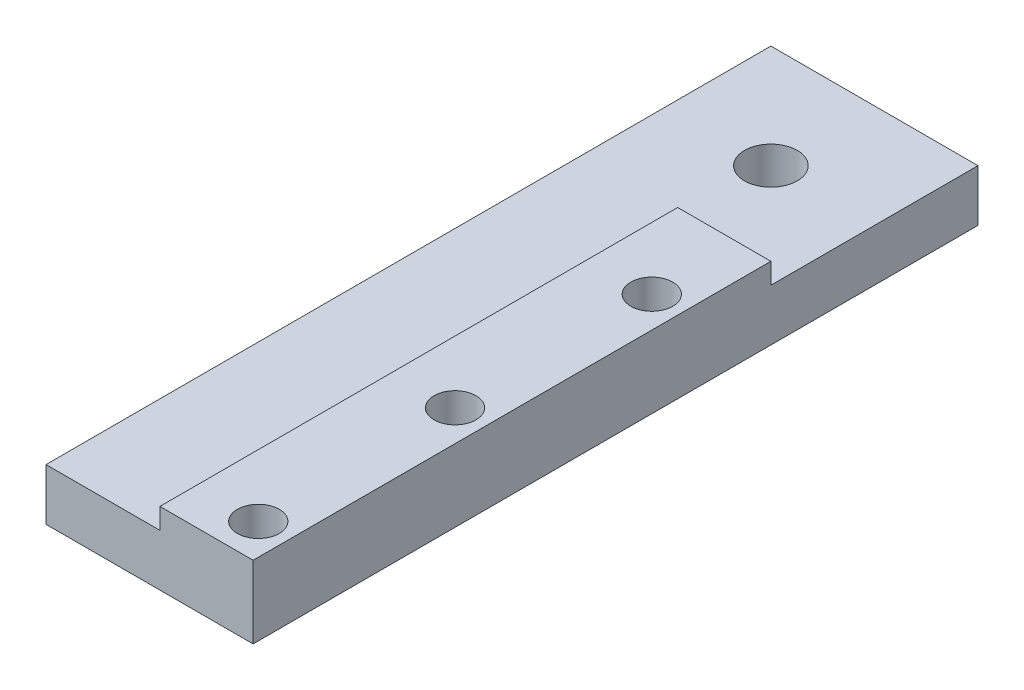
from build123d import *

# Parameters (mm, degrees)
SKETCH1_W           = 20
SKETCH1_H           = 70
SKETCH1_R           = 2.025
SKETCH1_R_2         = 2.55
BOSS_EXTRUDE1_DEPTH = 5
BOSS_EXTRUDE2_START = 2
SKETCH1_3_W         = 9
SKETCH1_3_H         = 50
SKETCH1_3_R         = 2.025
BOSS_EXTRUDE2_DEPTH = 2


with BuildPart() as part:
    # Sketch1 → Boss-Extrude1 (new body)
    with BuildSketch(Plane(origin=(0, 0, 0), x_dir=(1, 0, 0), z_dir=(0, 1, 0))):
        with Locations((-1, 35)):
            Rectangle(SKETCH1_W, SKETCH1_H)
        with Locations((6, 3.499356869)):
            Circle(SKETCH1_R, mode=Mode.SUBTRACT)
        with Locations((6, 22.499356869)):
            Circle(SKETCH1_R, mode=Mode.SUBTRACT)
        with Locations((6, 41.499356869)):
            Circle(SKETCH1_R, mode=Mode.SUBTRACT)
        with Locations((-1, 60)):
            Circle(SKETCH1_R_2, mode=Mode.SUBTRACT)
    extrude(amount=-BOSS_EXTRUDE1_DEPTH)

    # Sketch1<3> → Boss-Extrude2 (add)
    with BuildSketch(Plane(origin=(0, 0, 0), x_dir=(1, 0, 0), z_dir=(0, 1, 0)).offset(BOSS_EXTRUDE2_START)):
        with Locations((4.5, 25)):
            Rectangle(SKETCH1_3_W, SKETCH1_3_H)
        with Locations((6, 3.499356869)):
            Circle(SKETCH1_3_R, mode=Mode.SUBTRACT)
        with Locations((6, 22.499356869)):
            Circle(SKETCH1_3_R, mode=Mode.SUBTRACT)
        with Locations((6, 41.499356869)):
            Circle(SKETCH1_3_R, mode=Mode.SUBTRACT)
    extrude(amount=-BOSS_EXTRUDE2_DEPTH)


solid = part.part
